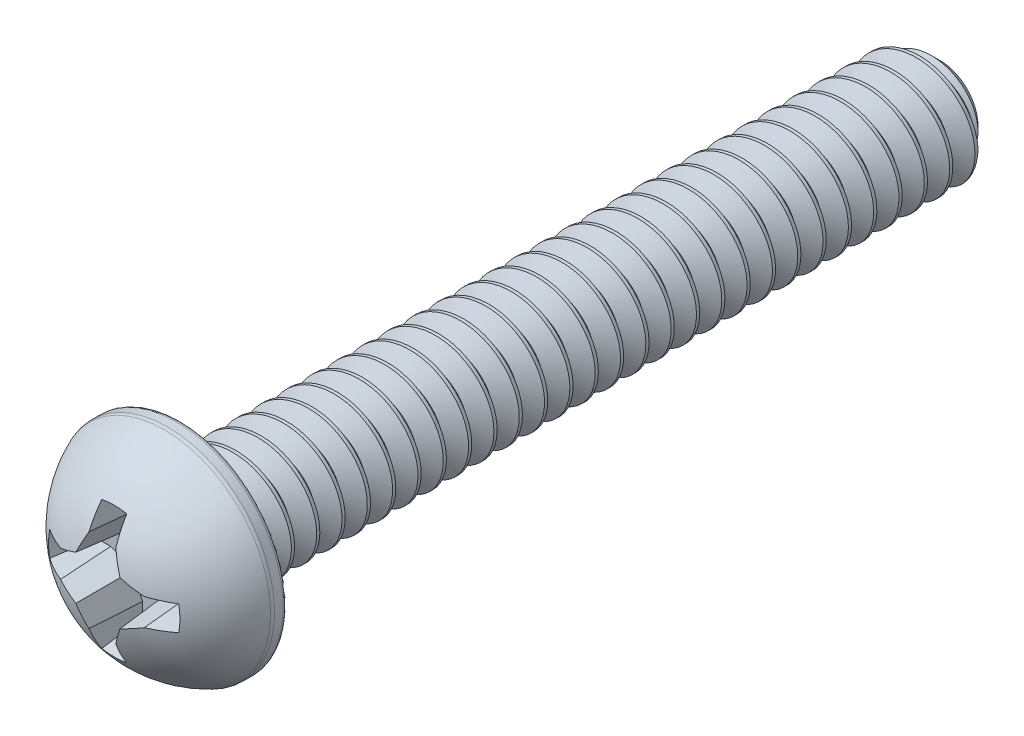
from build123d import *

# Parameters (mm, degrees)
SKETCH1_R          = 2.6796999999999995
EXTRUDE3_DEPTH     = 2.1844
CHAMFER1_SIZE      = 0.47625000000000006
CUT_SWEEP1_PITCH   = 0.6350000000000053
CUT_SWEEP1_TO      = 19.05
SKETCH26_R         = 0.5461
EXTRUDE8_DEPTH     = 2.132268765
CUT_EXTRUDE3_DEPTH = 1.4562666666666668
CIRPATTERN1_COUNT  = 4
DRAFT1_ANGLE       = 15.000000000000034
DRAFT2_ANGLE       = 5.000000000000011


with BuildPart() as part:
    # Sketch1 → Extrude3 (new body)
    with BuildSketch(Plane.XY):
        Circle(SKETCH1_R)
    extrude(amount=EXTRUDE3_DEPTH)

    # Sketch11 → Cut-Revolve3 (revolve, cut)
    with BuildSketch(Plane(origin=(0, 0, 0), x_dir=(0, 0, -1), z_dir=(1, 0, 0))):
        with BuildLine():
            Line((-2.4383999999999992, 3.1064199999999995), (-1.7e-16, 3.1064199999999995))
            Line((-1.7e-16, 3.1064199999999995), (-1e-16, 2.5704799999999994))
            ThreePointArc((-1e-16, 2.5704799999999994), (-0.03198979735880561, 2.647710202641194), (-0.1092200000000001, 2.679699999999999))
            Line((-0.1092200000000001, 2.679699999999999), (-0.3276600000000001, 2.679699999999999))
            ThreePointArc((-0.3276600000000001, 2.679699999999999), (-0.3706527055412052, 2.675427366492299), (-0.4119635572618461, 2.6627766093228997))
            ThreePointArc((-0.4119635572618461, 2.6627766093228997), (-1.7007743208814694, 1.599367860648657), (-2.1843999999999997, 1.1e-16))
            Line((-2.1843999999999997, 1.1e-16), (-2.4383999999999992, -3e-16))
            Line((-2.4383999999999992, -3e-16), (-2.4383999999999992, 3.1064199999999995))
        make_face()
    revolve(axis=Axis((0, 0, 0), (0, -1.2e-16, 1)), mode=Mode.SUBTRACT)



with BuildPart() as body_2:
    # Sketch4 → Revolve1 (revolve)
    with BuildSketch(Plane(origin=(0, 0, 0), x_dir=(0, 0, -1), z_dir=(1, 0, 0))):
        Polygon((0, 0), (19.05, 0), (19.05, 1.4224), (-1e-17, 1.4223999999999992), align=None)
    revolve(axis=Axis((0, 0, 0), (0, 0, -1)))

    # Chamfer1
    chamfer1_edges = [body_2.edges().sort_by_distance(p)[0] for p in [
        (1.7e-16, -1.4224, -19.05),
    ]]
    chamfer(chamfer1_edges, length=CHAMFER1_SIZE)

    # Cut-Sweep1: arcs per turn and ends read off the stored shape
    # Cut-Sweep1: the profile of Sketch14 profile screwed along a right-hand helix through 33 turns, 6 arcs to a turn; built about Z, then put on its axis
    cut_sweep1_z = Axis((0, 0, 0), (0, 0, 1))
    cut_sweep1_corners = [(1.4227, -4.97e-07, -0.158583743), (1.4227, -4.97e-07, -0.714541328), (0.992811128, -3.47e-07, -0.476250035), (0.992811128, -3.47e-07, -0.396875035)]
    with BuildLine(mode=Mode.PRIVATE) as cut_sweep1_profile:
        Line(cut_sweep1_corners[0], cut_sweep1_corners[1])
        Line(cut_sweep1_corners[1], cut_sweep1_corners[2])
        Line(cut_sweep1_corners[2], cut_sweep1_corners[3])
        Line(cut_sweep1_corners[3], cut_sweep1_corners[0])
    cut_sweep1_cap = Face(cut_sweep1_profile.wire())
    cut_sweep1_turn_angles = [0, 30, 60, 90, 120, 150, 180, 210, 240, 270, 300, 330, 360]
    cut_sweep1_turn_weights = [1, 0.8660254037844387, 1, 0.8660254037844387, 1, 0.8660254037844387, 1, 0.8660254037844387, 1, 0.8660254037844387, 1, 0.8660254037844387, 1]
    cut_sweep1_turn_rails = [Edge.make_bspline([Vector(p[0], p[1], 0).rotate(cut_sweep1_z, cut_sweep1_turn_angles[k]) / cut_sweep1_turn_weights[k] + Vector(0, 0, p[2] + CUT_SWEEP1_PITCH * cut_sweep1_turn_angles[k] / 360) for k in range(13)], [0, 0, 0, 1, 1, 2, 2, 3, 3, 4, 4, 5, 5, 6, 6, 6], 2, cut_sweep1_turn_weights) for p in cut_sweep1_corners]
    cut_sweep1_turn_sides = [Face.make_surface_from_curves(cut_sweep1_turn_rails[p[0]], cut_sweep1_turn_rails[p[1]]) for p in [(0, 1), (1, 2), (2, 3), (3, 0)]]
    cut_sweep1 = Plane(origin=(0, 0, -19.05), x_dir=(1, -3.49e-15, 0), z_dir=(0, 0, 1)) * split(Solid(Shell([*[p.moved(Location((0, 0, CUT_SWEEP1_PITCH * i))) for i in range(33) for p in cut_sweep1_turn_sides], cut_sweep1_cap, cut_sweep1_cap.rotate(cut_sweep1_z, 11880).moved(Location((0, 0, CUT_SWEEP1_PITCH * 11880 / 360)))])), bisect_by=Plane.XY.offset(CUT_SWEEP1_TO), keep=Keep.BOTTOM, mode=Mode.PRIVATE)
    add(cut_sweep1, mode=Mode.SUBTRACT)


with BuildPart() as part_1:
    add(part.part)

    add(body_2.part)  # Extrude8 merges body 2
    # Sketch26 → Extrude8 (add)
    with BuildSketch(Plane.XY):
        Circle(SKETCH26_R)
    extrude(amount=EXTRUDE8_DEPTH)

    # Sketch12 → Cut-Extrude3 (cut)
    with BuildSketch(Plane.XY.offset(2.1843999999999997)):
        with BuildLine():
            Line((1.7503727103296218, 0.35729333333333346), (1.0538330218314778, 0.3572933333333336))
            Line((1.0538330218314778, 0.3572933333333336), (0.5613050847288744, 0.5613050847288744))
            Line((0.5613050847288744, 0.5613050847288744), (0.35729333333333335, 1.0538330218314778))
            Line((0.35729333333333335, 1.0538330218314778), (0.35729333333333335, 1.7503727103296218))
            ThreePointArc((0.35729333333333335, 1.7503727103296218), (0.17955591032357107, 1.7774202728052206), (0, 1.7864666666666666))
            Line((0, 1.7864666666666666), (0, 3.3e-16))
            Line((0, 3.3e-16), (1.7864666666666662, 4.3e-16))
            ThreePointArc((1.7864666666666662, 4.3e-16), (1.7774202728052202, 0.17955591032357113), (1.7503727103296218, 0.35729333333333346))
        make_face()
    cut_extrude3 = extrude(amount=-CUT_EXTRUDE3_DEPTH, mode=Mode.SUBTRACT)

    # CirPattern1: Cut-Extrude3 ×4 about axis
    cirpattern1_axis = Axis((-2e-17, -2e-17, 0), (0, 0, 1))
    for i in range(1, CIRPATTERN1_COUNT):
        add(cut_extrude3.rotate(cirpattern1_axis, i * 360 / CIRPATTERN1_COUNT), mode=Mode.SUBTRACT)

    # Draft1
    draft1_faces = [part_1.faces().sort_by_distance(p)[0] for p in [
        (-1.7864666666666666, 3.99e-15, 1.1466272083675035),
        (-4.14e-15, -1.7864666666666666, 1.1466272083675042),
        (1.7864666666666666, -3.98e-15, 1.1466272083675038),
        (-1.3e-16, 1.786466666666666, 1.1466272083675029),
    ]]
    draft(draft1_faces, Plane.XY.offset(2.1843999999999997), DRAFT1_ANGLE)

    # Draft2
    draft2_faces = [part_1.faces().sort_by_distance(p)[0] for p in [
        (0.35729333333333335, 1.2684050568817975, 1.3407547378194864),
        (0.46076067394885706, 0.8040407648548038, 1.3776063614735639),
        (0.8040407648548039, 0.46076067394885706, 1.377606361473564),
        (1.2684050465917887, 0.3572933333333335, 1.3407546843529614),
        (1.268405046591789, -0.3572933333333337, 1.3407546843529614),
        (0.8040407648548037, -0.4607606739488573, 1.3776063614735643),
        (0.46076067394885695, -0.8040407648548039, 1.3776063614735643),
        (0.35729333333333324, -1.2684050465917887, 1.340754684352962),
        (-0.3572933333333336, -1.268405046591789, 1.3407546843529616),
        (-0.4607606739488572, -0.8040407648548038, 1.3776063614735643),
        (-0.804040764854804, -0.4607606739488571, 1.3776063614735643),
        (-1.2684050465917887, -0.35729333333333346, 1.3407546843529619),
        (-1.268405046591789, 0.3572933333333335, 1.3407546843529614),
        (-0.8040407648548038, 0.46076067394885717, 1.377606361473564),
        (-0.46076067394885706, 0.8040407648548039, 1.3776063614735639),
        (-0.35729333333333346, 1.268405046591787, 1.3407546843529592),
    ]]
    draft(draft2_faces, Plane.XY.offset(2.1843999999999997), DRAFT2_ANGLE)


solid = part_1.part
